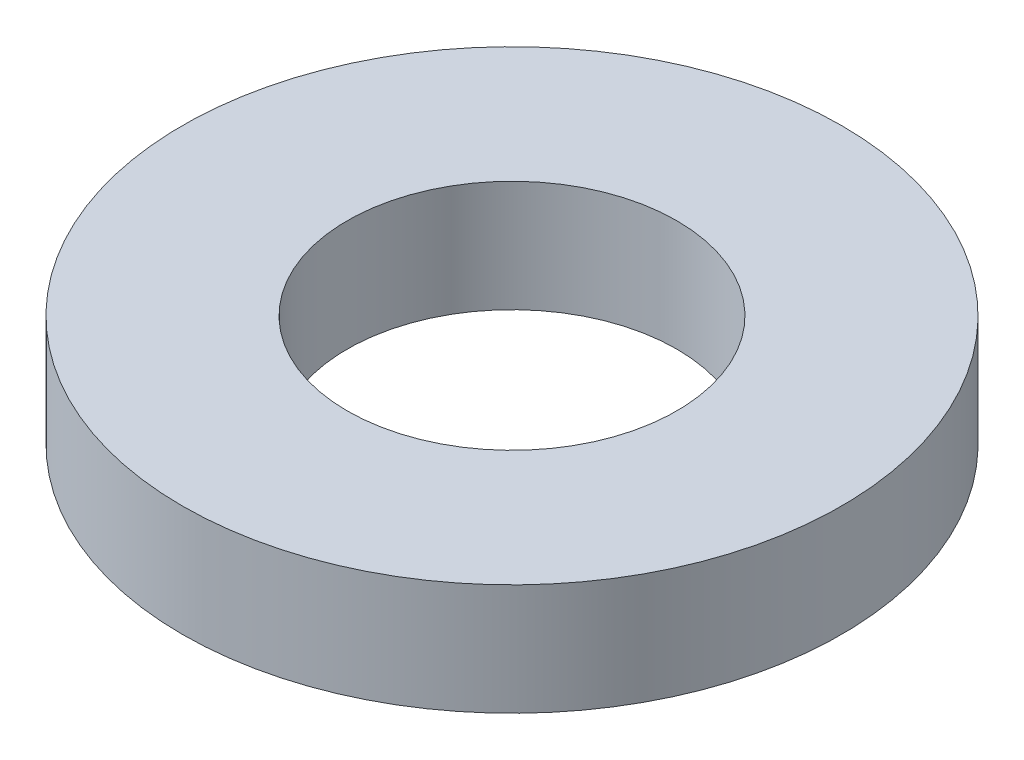
from build123d import *

# Parameters (mm, degrees)
SKETCH1_R           = 80
BOSS_EXTRUDE1_DEPTH = 27
SKETCH2_R           = 40
CUT_EXTRUDE1_DEPTH  = 117.314229568


with BuildPart() as part:
    # Sketch1 → Boss-Extrude1 (new body)
    with BuildSketch(Plane(origin=(0, 0, 0), x_dir=(1, 0, 0), z_dir=(0, 1, 0))):
        Circle(SKETCH1_R)
    extrude(amount=BOSS_EXTRUDE1_DEPTH)

    # Sketch2 → Cut-Extrude1 (cut, through all)
    with BuildSketch(Plane(origin=(0, 0, 0), x_dir=(1, 0, 0), z_dir=(0, 1, 0))):
        Circle(SKETCH2_R)
    extrude(amount=CUT_EXTRUDE1_DEPTH, mode=Mode.SUBTRACT)


solid = part.part
